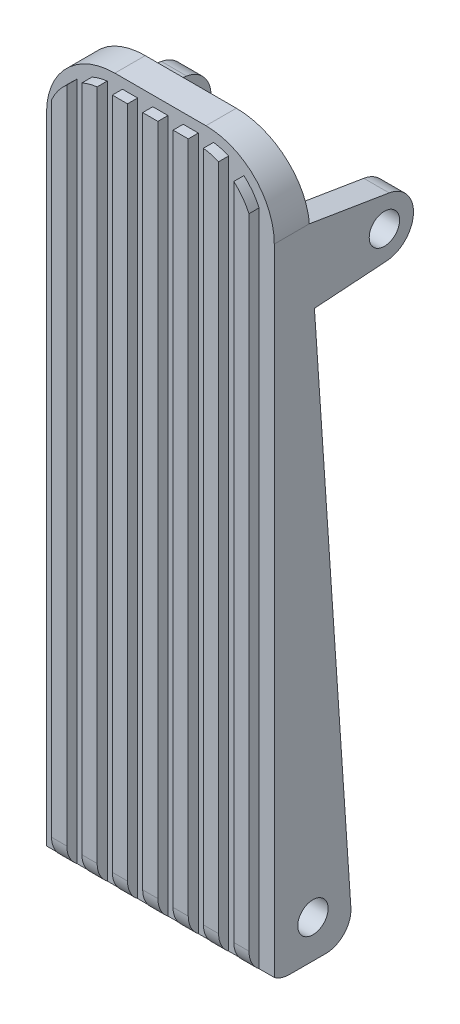
from build123d import *

# Parameters (mm, degrees)
SKETCH1_W              = 57.15
SKETCH1_H              = 177.8
BOSS_EXTRUDE1_DEPTH    = 22.225
CUT_EXTRUDE1_DEPTH     = 149.86
FILLET1_R              = 17.145
FILLET2_R              = 6.35
SKETCH4_W              = 3.81
SKETCH4_H              = 2.54
CUT_EXTRUDE2_DEPTH     = 215.392
CUT_EXTRUDE5_START     = 14.224
CUT_EXTRUDE5_DEPTH     = 14.224
SKETCH6_R              = 3.81
CUT_EXTRUDE6_DEPTH     = 117.856
SKETCH7_R              = 3.81
BOSS_EXTRUDE2_DEPTH    = 6.35
CUT_EXTRUDE7_START     = 9.525
CUT_EXTRUDE7_OUTLINE_R = 3.81
CUT_EXTRUDE7_DEPTH     = 38.1
FILLET3_R              = 6.35


# Read off the part's stored shape, not the designer's step: Cut-Extrude7
with BuildPart() as part:
    # Sketch1 → Boss-Extrude1 (new body)
    with BuildSketch(Plane.XY):
        with Locations((28.575, 88.9)):
            Rectangle(SKETCH1_W, SKETCH1_H)
    extrude(amount=BOSS_EXTRUDE1_DEPTH)

    # Sketch3 → Cut-Extrude1 (cut)
    with BuildSketch(Plane.ZY):
        Polygon((0, 0), (12.065, 177.8), (0, 177.8), align=None)
    extrude(amount=-CUT_EXTRUDE1_DEPTH, mode=Mode.SUBTRACT)

    # Fillet1
    fillet1_edges = [part.edges().sort_by_distance(p)[0] for p in [
        (0, 177.8, 17.145),
        (57.15, 177.8, 17.145),
    ]]
    fillet(fillet1_edges, radius=FILLET1_R)

    # Fillet2
    fillet2_edges = [part.edges().sort_by_distance(p)[0] for p in [
        (28.575, 0, 0),
        (28.575, 0, 22.225),
    ]]
    fillet(fillet2_edges, radius=FILLET2_R)

    # Sketch4 → Cut-Extrude2 (cut)
    with BuildSketch(Plane.XZ):
        with Locations((1.905, 20.955)):
            Rectangle(SKETCH4_W, SKETCH4_H)
        with Locations((9.525, 20.955)):
            Rectangle(SKETCH4_W, SKETCH4_H)
        with Locations((17.145, 20.955)):
            Rectangle(SKETCH4_W, SKETCH4_H)
        with Locations((24.765, 20.955)):
            Rectangle(SKETCH4_W, SKETCH4_H)
        with Locations((32.385, 20.955)):
            Rectangle(SKETCH4_W, SKETCH4_H)
        with Locations((40.005, 20.955)):
            Rectangle(SKETCH4_W, SKETCH4_H)
        with Locations((47.625, 20.955)):
            Rectangle(SKETCH4_W, SKETCH4_H)
        with Locations((55.245, 20.955)):
            Rectangle(SKETCH4_W, SKETCH4_H)
    extrude(amount=-CUT_EXTRUDE2_DEPTH, mode=Mode.SUBTRACT)

    # Sketch5 → Cut-Extrude5 (cut)
    with BuildSketch(Plane.XY.offset(19.685).offset(CUT_EXTRUDE5_START)):
        with BuildLine():
            Line((2.54, 160.655), (0, 160.655))
            ThreePointArc((0, 160.655), (0.980538982, 166.37), (3.81, 171.431307345))
            ThreePointArc((3.81, 171.431307345), (5.583362193, 173.315156248), (7.62, 174.910714644))
            ThreePointArc((7.62, 174.910714644), (9.46546693, 175.983920276), (11.43, 176.819461018))
            ThreePointArc((11.43, 176.819461018), (13.309998856, 177.365589195), (15.24, 177.693837989))
            ThreePointArc((15.24, 177.693837989), (16.191022095, 177.773438923), (17.145, 177.8))
            Line((17.145, 177.8), (19.05, 177.8))
            Line((19.05, 177.8), (22.86, 177.8))
            Line((22.86, 177.8), (26.67, 177.8))
            Line((26.67, 177.8), (30.48, 177.8))
            Line((30.48, 177.8), (34.29, 177.8))
            Line((34.29, 177.8), (38.1, 177.8))
            Line((38.1, 177.8), (40.005, 177.8))
            ThreePointArc((40.005, 177.8), (40.958977905, 177.773438923), (41.91, 177.693837989))
            ThreePointArc((41.91, 177.693837989), (43.840001144, 177.365589195), (45.72, 176.819461018))
            ThreePointArc((45.72, 176.819461018), (47.68453307, 175.983920276), (49.53, 174.910714644))
            ThreePointArc((49.53, 174.910714644), (51.566637807, 173.315156248), (53.34, 171.431307345))
            ThreePointArc((53.34, 171.431307345), (56.169461018, 166.37), (57.15, 160.655))
            Line((57.15, 160.655), (54.61, 160.655))
            ThreePointArc((54.61, 160.655), (53.774726052, 165.523333333), (51.364444444, 169.834817368))
            ThreePointArc((51.364444444, 169.834817368), (49.853802577, 171.439577544), (48.118888889, 172.798756919))
            ThreePointArc((48.118888889, 172.798756919), (46.546824467, 173.712969124), (44.873333333, 174.424726052))
            ThreePointArc((44.873333333, 174.424726052), (43.271852826, 174.889946351), (41.627777778, 175.169565694))
            ThreePointArc((41.627777778, 175.169565694), (40.817647845, 175.237373897), (40.005, 175.26))
            Line((40.005, 175.26), (38.1, 175.26))
            Line((38.1, 175.26), (34.29, 175.26))
            Line((34.29, 175.26), (30.48, 175.26))
            Line((30.48, 175.26), (26.67, 175.26))
            Line((26.67, 175.26), (22.86, 175.26))
            Line((22.86, 175.26), (19.05, 175.26))
            Line((19.05, 175.26), (17.145, 175.26))
            ThreePointArc((17.145, 175.26), (16.332352155, 175.237373897), (15.522222222, 175.169565694))
            ThreePointArc((15.522222222, 175.169565694), (13.878147174, 174.889946351), (12.276666667, 174.424726052))
            ThreePointArc((12.276666667, 174.424726052), (10.603175533, 173.712969124), (9.031111111, 172.798756919))
            ThreePointArc((9.031111111, 172.798756919), (7.296197423, 171.439577544), (5.785555556, 169.834817368))
            ThreePointArc((5.785555556, 169.834817368), (3.375273948, 165.523333333), (2.54, 160.655))
        make_face()
    extrude(amount=-CUT_EXTRUDE5_DEPTH, mode=Mode.SUBTRACT)

    # Sketch6 → Cut-Extrude6 (cut)
    with BuildSketch(Plane.ZY):
        with Locations((9.98506493, 9.525)):
            Circle(SKETCH6_R)
    extrude(amount=-CUT_EXTRUDE6_DEPTH, mode=Mode.SUBTRACT)

    # Sketch7 → Boss-Extrude2 (add)
    with BuildSketch(Plane.ZY):
        with BuildLine():
            Line((9.611876604, 141.648707852), (10.901589286, 160.655))
            Line((10.901589286, 160.655), (-9.13281329, 157.365703773))
            ThreePointArc((-9.13281329, 157.365703773), (-15.243978439, 149.813024962), (-8.444101503, 142.873934938))
            Line((-8.444101503, 142.873934938), (9.611876604, 141.648707852))
        make_face()
        with Locations((-7.949711075, 150.159680223)):
            Circle(SKETCH7_R, mode=Mode.SUBTRACT)
    boss_extrude2 = extrude(amount=-BOSS_EXTRUDE2_DEPTH)

    # Mirror1: Boss-Extrude2 across plane
    add(boss_extrude2.mirror(Plane.ZY.offset(-28.575)))

    # Cut-Extrude7 outline → Cut-Extrude7 (cut)
    with BuildSketch(Plane.YZ.offset(CUT_EXTRUDE7_START)):
        with BuildLine():
            Line((6.779904227, 0.46006493), (25.786196375, 1.749777611))
            Line((25.786196375, 1.749777611), (24.784609855, 16.51))
            Line((24.784609855, 16.51), (0.031829774, 16.51))
            ThreePointArc((0.031829774, 16.51), (0.007962436, 16.192898622), (0, 15.875))
            Line((0, 15.875), (0, 6.795495646))
            ThreePointArc((0, 6.795495646), (2.014529544, 2.155862479), (6.779904227, 0.46006493))
        make_face()
        with Locations((9.525, 9.98506493)):
            Circle(CUT_EXTRUDE7_OUTLINE_R, mode=Mode.SUBTRACT)
    extrude(amount=CUT_EXTRUDE7_DEPTH, mode=Mode.SUBTRACT)

    # Fillet3
    fillet3_edges = [part.edges().sort_by_distance(p)[0] for p in [
        (28.575, 25.786196375, 1.749777611),
        (28.575, 24.784609855, 16.51),
    ]]
    fillet(fillet3_edges, radius=FILLET3_R)


solid = part.part
